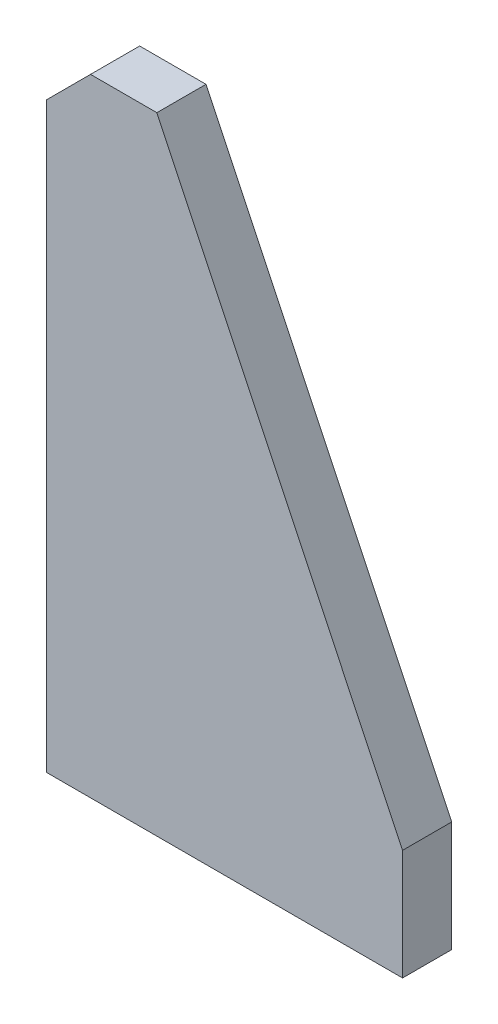
from build123d import *

# Parameters (mm, degrees)
EXTRUDE_1_DEPTH = 20


with BuildPart() as part:
    # Эскиз1 → Бобышка-Вытянуть1 (new body)
    with BuildSketch(Plane.XY):
        Polygon((0, 0), (0, 45), (-100, 255), (-127, 255), (-145, 237), (-145, 0), align=None)
    extrude(amount=EXTRUDE_1_DEPTH)


solid = part.part
